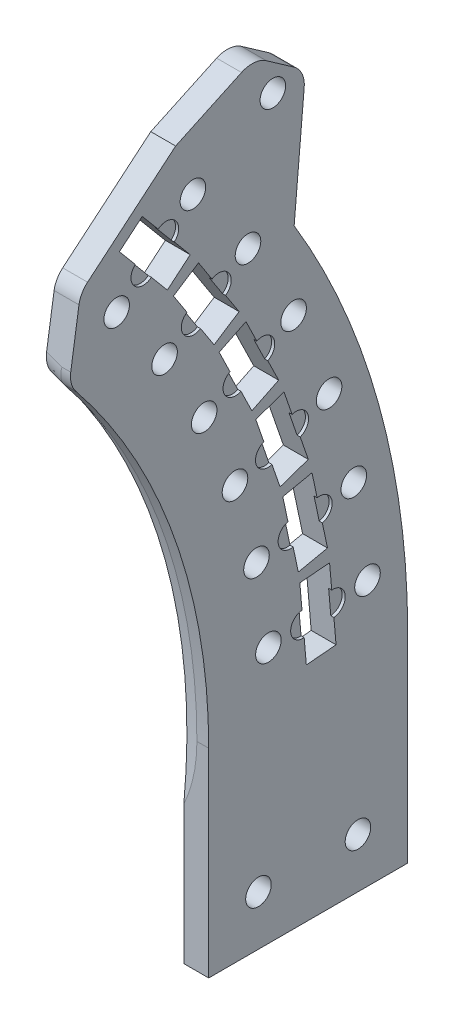
from build123d import *
from build123d.topology import SkipClean

# Parameters (mm, degrees)
SKETCH1_R               = 3.2639
BOSS_EXTRUDE1_DEPTH     = 6.35
FILLET1_R               = 6.35
SKETCH6_R               = 3.2639
CUT_EXTRUDE1_DEPTH      = 246.360186308
CUT_EXTRUDE2_START      = -0.79375
CUT_EXTRUDE2_DEPTH      = 10.82675
CIRPATTERN1_COUNT       = 6
CIRPATTERN1_ANGLE       = 35
BOSS_EXTRUDE2_DEPTH     = 6.35
CUT_EXTRUDE3_DEPTH      = 251.739762675
CUT_EXTRUDE3_DEPTH_BACK = 251.739762675
SKETCH9_R               = 3.2639
FILLET2_R               = 6.35


with BuildPart() as part:
    # Sketch1 → Boss-Extrude1 (new body)
    with BuildSketch(Plane(origin=(0, 0, 0), x_dir=(0, 0, -1), z_dir=(1, 0, 0))):
        with BuildLine():
            Line((152.4, 0), (152.4, -50.8))
            Line((152.4, -50.8), (203.2, -50.8))
            Line((203.2, -50.8), (203.2, 0))
            ThreePointArc((203.2, 0), (190.945540544, 69.498493124), (155.660230842, 130.614442288))
            Line((155.660230842, 130.614442288), (143.955847531, 137.371971144))
            Line((143.955847531, 137.371971144), (119.633936462, 116.963464536))
            Line((119.633936462, 116.963464536), (116.745173131, 97.960831716))
            ThreePointArc((116.745173131, 97.960831716), (143.209155408, 52.123869843), (152.4, 0))
        make_face()
        with Locations((165.1, -38.1)):
            Circle(SKETCH1_R, mode=Mode.SUBTRACT)
        with Locations((190.5, -38.1)):
            Circle(SKETCH1_R, mode=Mode.SUBTRACT)
    extrude(amount=BOSS_EXTRUDE1_DEPTH)

    # Sketch2 → Cut-Revolve2 (revolve, cut)
    with SkipClean():  # the faces are left unmerged after this step: merging them gives an invalid solid
        with BuildSketch(Plane(origin=(0, 0, 0), x_dir=(1, 0, 0), z_dir=(0, 1, 0))):
            with BuildLine():
                Line((-143.256, 38.1), (-25.4, 38.1))
                Line((-25.4, 38.1), (92.456, 38.1))
                ThreePointArc((92.456, 38.1), (-25.4, 155.956), (-143.256, 38.1))
            make_face()
        revolve(axis=Axis((0, 0, 0), (-1, 0, 0)), mode=Mode.SUBTRACT)
    add(part.part.scale(1), mode=Mode.REPLACE)  # the faces are merged on a copy

    # Fillet1
    fillet1_edges = [part.edges().sort_by_distance(p)[0] for p in [
        (4.841164554, 97.960831716, -116.745173131),
        (1.671163996, 98.49343633, -116.826139211),
        (3.175, 116.963464536, -119.633936462),
        (3.175, 130.614442288, -155.660230842),
    ]]
    fillet(fillet1_edges, radius=FILLET1_R)

    # Sketch6 → Cut-Extrude1 (cut, through all)
    with BuildSketch(Plane(origin=(6.35, 0, 0), x_dir=(0, 0, -1), z_dir=(1, 0, 0))):
        with Locations((167.634662821, 14.666132611)):
            Circle(SKETCH6_R)
        with Locations((192.938008153, 16.879888477)):
            Circle(SKETCH6_R)
        with Locations((164.597787513, 34.986339772)):
            Circle(SKETCH6_R)
        with Locations((189.442736572, 40.267296719)):
            Circle(SKETCH6_R)
        with Locations((159.107138309, 54.784981191)):
            Circle(SKETCH6_R)
        with Locations((183.123310129, 63.054412314)):
            Circle(SKETCH6_R)
        with Locations((151.244568141, 73.766904726)):
            Circle(SKETCH6_R)
        with Locations((174.073936917, 84.901531854)):
            Circle(SKETCH6_R)
        with Locations((141.127289821, 91.649133617)):
            Circle(SKETCH6_R)
        with Locations((162.429522247, 105.482965107)):
            Circle(SKETCH6_R)
        with Locations((128.906128666, 108.16508502)):
            Circle(SKETCH6_R)
        with Locations((148.363657521, 124.491890306)):
            Circle(SKETCH6_R)
        Polygon((175.660675238, 24.929701663), (177.320992137, 5.952192665), (184.911995737, 6.616319424), (183.251678837, 25.593828423), align=None)
        Polygon((182.727363257, 29.102105891), (175.273878539, 27.517818807), (171.313160829, 46.151530601), (178.766645547, 47.735817685), align=None)
        Polygon((177.818686663, 51.154046989), (170.613835117, 48.673217652), (164.411761775, 66.685346517), (171.616613321, 69.166175854), align=None)
        Polygon((170.259143019, 72.443399068), (163.410332386, 69.10301093), (155.059362039, 86.225037512), (161.908172672, 89.56542565), align=None)
        Polygon((160.161427706, 92.652786926), (153.770757979, 88.502637479), (143.395384362, 104.479311798), (149.786054089, 108.629461245), align=None)
        Polygon((147.676074404, 111.480935135), (141.838815747, 106.582893549), (129.593711783, 121.176040191), (135.430970439, 126.074081777), align=None)
    extrude(amount=-CUT_EXTRUDE1_DEPTH, mode=Mode.SUBTRACT)

    # Sketch8 → Cut-Extrude2 (cut)
    with BuildSketch(Plane(origin=(6.35, 15.551634957, -177.756000954), x_dir=(0, 0.08715574274765883, -0.9961946980917454), z_dir=(1, 0, 0)).offset(CUT_EXTRUDE2_START)):
        with BuildLine():
            Line((6.35, 3.175), (-1.27, 3.175))
            ThreePointArc((-1.27, 3.175), (-4.445, 0), (-1.27, -3.175))
            Line((-1.27, -3.175), (6.35, -3.175))
            ThreePointArc((6.35, -3.175), (9.525, 0), (6.35, 3.175))
        make_face()
    cut_extrude2 = extrude(amount=CUT_EXTRUDE2_DEPTH, mode=Mode.SUBTRACT)

    # CirPattern1: Cut-Extrude2 ×6 about axis
    cirpattern1_axis = Axis((6.35, 0, 0), (1, 0, 0))
    for i in range(1, CIRPATTERN1_COUNT):
        add(cut_extrude2.rotate(cirpattern1_axis, i * CIRPATTERN1_ANGLE / (CIRPATTERN1_COUNT - 1)), mode=Mode.SUBTRACT)

    # Sketch11 → Boss-Extrude2 (add)
    with BuildSketch(Plane(origin=(6.35, 0, 0), x_dir=(0, 0, -1), z_dir=(1, 0, 0))):
        with BuildLine():
            Line((164.098538098, 146.764662011), (143.955847531, 137.371971144))
            Line((143.955847531, 137.371971144), (154.682623198, 131.178864325))
            ThreePointArc((154.682623198, 131.178864325), (155.603036102, 130.532446831), (156.394965882, 129.733783753))
            ThreePointArc((156.394965882, 129.733783753), (165.779619803, 117.504713343), (174.21022582, 104.599413095))
            Line((174.21022582, 104.599413095), (177.102576801, 137.659136084))
            Line((177.102576801, 137.659136084), (164.098538098, 146.764662011))
        make_face()
    extrude(amount=-BOSS_EXTRUDE2_DEPTH)

    # Sketch9 → Cut-Extrude3 (cut, two sides: drawn at the far end of the back side and taken through both)
    with BuildSketch(Plane(origin=(6.35, 0, 0), x_dir=(0, 0, -1), z_dir=(1, 0, 0)).offset(-CUT_EXTRUDE3_DEPTH_BACK)):
        with Locations((168.77278845, 136.669509324)):
            Circle(SKETCH9_R)
    extrude(amount=CUT_EXTRUDE3_DEPTH + CUT_EXTRUDE3_DEPTH_BACK, mode=Mode.SUBTRACT)

    # Fillet2
    fillet2_edges = [part.edges().sort_by_distance(p)[0] for p in [
        (3.175, 137.659136084, -177.102576801),
        (3.175, 146.764662011, -164.098538098),
    ]]
    fillet(fillet2_edges, radius=FILLET2_R)


solid = part.part
